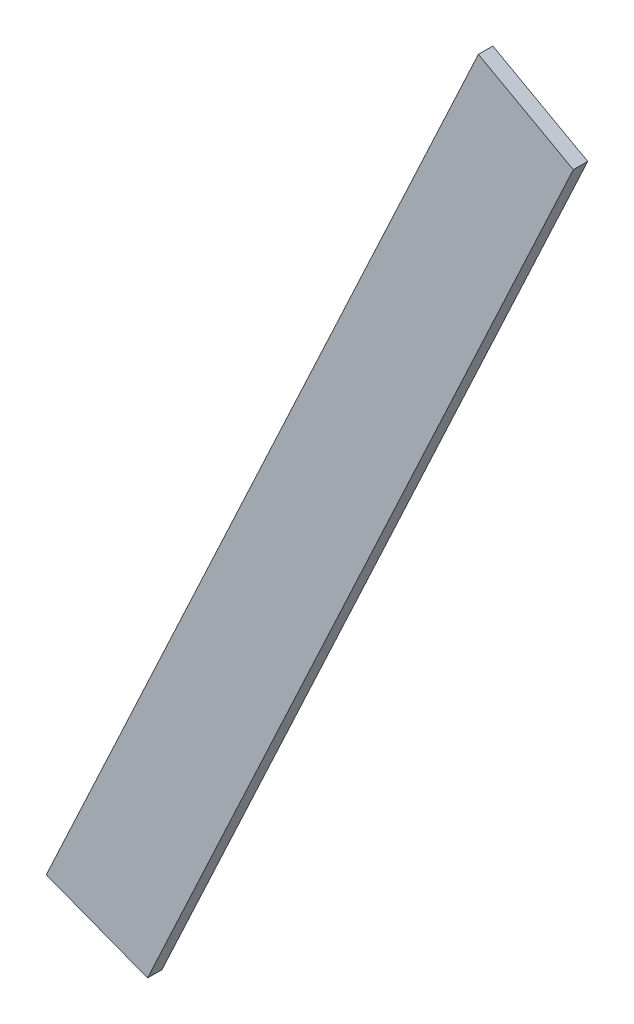
from build123d import *

# Parameters (mm, degrees)
BOSS_EXTRUDE1_DEPTH = 2


with BuildPart() as part:
    # Sketch1 → Boss-Extrude1 (new body)
    with BuildSketch(Plane.XY):
        Polygon((31.526473659, -12.503809008), (17.481993472, -7.129148163), (77.39510574, 121.338685913), (90.55292236, 114.062809396), align=None)
    extrude(amount=BOSS_EXTRUDE1_DEPTH)


solid = part.part
